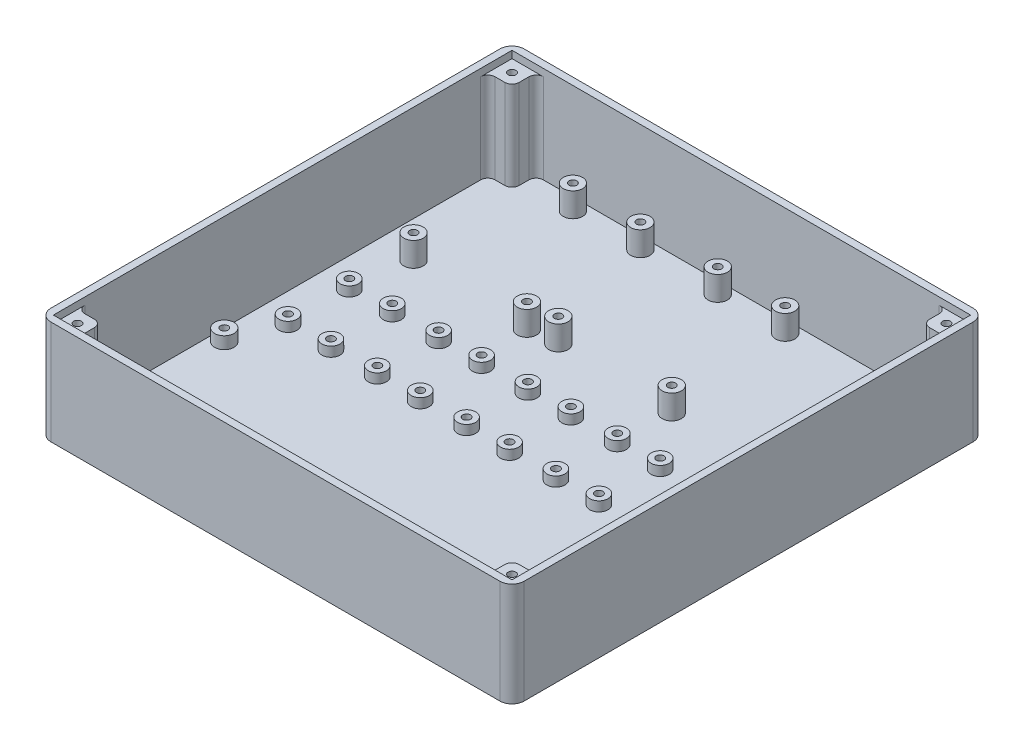
from build123d import *

# Parameters (mm, degrees)
SKETCH1_W               = 190
SKETCH1_H               = 190
BOSS_EXTRUDE1_DEPTH     = 40
SHELL1_T                = 3
FILLET1_R               = 5
SKETCH5_W               = 10
SKETCH5_H               = 10
SKETCH5_R               = 1.6
BOSS_EXTRUDE3_DEPTH     = 37
MIRROR2_COPY_1_SKETCH_W = 10
MIRROR2_COPY_1_SKETCH_H = 10
MIRROR2_COPY_1_SKETCH_R = 1.6
MIRROR2_COPY_1_DEPTH    = 37
FILLET3_R               = 3
SKETCH6_R               = 3.75
SKETCH6_R_2             = 1.6
BOSS_EXTRUDE4_DEPTH     = 7
LPATTERN1_COUNT         = 5
LPATTERN1_PITCH         = 37
SKETCH7_R               = 4
SKETCH7_R_2             = 1.6
BOSS_EXTRUDE5_DEPTH     = 5
SKETCH8_R               = 4
SKETCH8_R_2             = 1.6
BOSS_EXTRUDE6_DEPTH     = 10
LPATTERN2_COUNT         = 2
LPATTERN2_PITCH         = 60


with BuildPart() as part:
    # Sketch1 → Boss-Extrude1 (new body)
    with BuildSketch(Plane(origin=(0, 0, 0), x_dir=(1, 0, 0), z_dir=(0, 1, 0))):
        Rectangle(SKETCH1_W, SKETCH1_H)
    extrude(amount=BOSS_EXTRUDE1_DEPTH)

    # Shell1
    shell1_openings = [part.faces().sort_by_distance(p)[0] for p in [
        (0, 40, 0),
    ]]
    offset(amount=SHELL1_T, openings=shell1_openings, kind=Kind.INTERSECTION)

    # Fillet1
    # the kernel refuses this fillet: 5 mm, written as the material it takes off along each edge
    with BuildSketch(Plane(origin=(-98, 52.5, 98), x_dir=(1, 0, 0), z_dir=(0, -1, 0)), Plane(origin=(98, -15.5, 98), x_dir=(-1, 0, 0), z_dir=(0, 1, 0)), Plane(origin=(98, -15.5, -98), x_dir=(0, 0, 1), z_dir=(0, 1, 0)), Plane(origin=(-98, -15.5, -98), x_dir=(1, 0, 0), z_dir=(0, 1, 0))) as fillet1_piece_1:
        with BuildLine():
            CenterArc((FILLET1_R, -FILLET1_R), FILLET1_R, 90, 90)
            Line((0, -FILLET1_R), (0, 0))
            Line((0, 0), (FILLET1_R, 0))
        make_face()
    extrude(amount=68, mode=Mode.SUBTRACT)

    # Sketch5 → Boss-Extrude3 (add)
    with BuildSketch(Plane(origin=(0, 0, 0), x_dir=(1, 0, 0), z_dir=(0, 1, 0))):
        with Locations((-90, 90)):
            Rectangle(SKETCH5_W, SKETCH5_H)
        with Locations(Location((-90, 90, 0), (0, 0, 270))):
            Circle(SKETCH5_R, mode=Mode.SUBTRACT)
    boss_extrude3 = extrude(amount=BOSS_EXTRUDE3_DEPTH)

    # Mirror1: Boss-Extrude3 across plane
    add(boss_extrude3.mirror(Plane(origin=(0, 0, 0), x_dir=(0, 0, 1), z_dir=(1, 0, 0))))

    # Mirror2: Boss-Extrude3 across plane
    add(boss_extrude3.mirror(Plane.XY))

    # Mirror2 copy 1 sketch → Mirror2 copy 1 (add)
    with BuildSketch(Plane(origin=(0, 0, 0), x_dir=(-1, 0, 0), z_dir=(0, 1, 0))):
        with Locations((-90, 90)):
            Rectangle(MIRROR2_COPY_1_SKETCH_W, MIRROR2_COPY_1_SKETCH_H)
        with Locations(Location((-90, 90, 0), (0, 0, 270))):
            Circle(MIRROR2_COPY_1_SKETCH_R, mode=Mode.SUBTRACT)
    extrude(amount=MIRROR2_COPY_1_DEPTH)

    # Fillet3
    fillet3_edges = [part.edges().sort_by_distance(p)[0] for p in [
        (-95, 18.5, 85),
        (-85, 18.5, 95),
        (-85, 18.5, 85),
        (-95, 18.5, -85),
        (-85, 18.5, -85),
        (-85, 18.5, -95),
        (95, 18.5, -85),
        (85, 18.5, -95),
        (85, 18.5, -85),
        (95, 18.5, 85),
        (85, 18.5, 85),
        (85, 18.5, 95),
    ]]
    fillet(fillet3_edges, radius=FILLET3_R)

    # Sketch6 → Boss-Extrude4 (add)
    # profile 1 of 4: a face of its own
    with BuildSketch(Plane(origin=(0, -3, 0), x_dir=(1, 0, 0), z_dir=(0, 1, 0))):
        with Locations(Location((-65, 15.4, 0), (0, 0, 90))):
            Circle(SKETCH6_R)
        with Locations(Location((-65, 15.4, 0), (0, 0, 90))):
            Circle(SKETCH6_R_2, mode=Mode.SUBTRACT)
    # profile 2 of 4: a face of its own
    with BuildSketch(Plane(origin=(0, -3, 0), x_dir=(1, 0, 0), z_dir=(0, 1, 0))):
        with Locations(Location((-65, -10, 0), (0, 0, 90))):
            Circle(SKETCH6_R)
        with Locations(Location((-65, -10, 0), (0, 0, 90))):
            Circle(SKETCH6_R_2, mode=Mode.SUBTRACT)
    # profile 3 of 4: a face of its own
    with BuildSketch(Plane(origin=(0, -3, 0), x_dir=(1, 0, 0), z_dir=(0, 1, 0))):
        with Locations(Location((-82.8, 15.4, 0), (0, 0, 90))):
            Circle(SKETCH6_R)
        with Locations(Location((-82.8, 15.4, 0), (0, 0, 90))):
            Circle(SKETCH6_R_2, mode=Mode.SUBTRACT)
    # profile 4 of 4: a face of its own
    with BuildSketch(Plane(origin=(0, -3, 0), x_dir=(1, 0, 0), z_dir=(0, 1, 0))):
        with Locations(Location((-82.8, -10, 0), (0, 0, 90))):
            Circle(SKETCH6_R)
        with Locations(Location((-82.8, -10, 0), (0, 0, 90))):
            Circle(SKETCH6_R_2, mode=Mode.SUBTRACT)
    boss_extrude4 = extrude(amount=BOSS_EXTRUDE4_DEPTH)

    # LPattern1: Boss-Extrude4 ×5
    with Locations(*[(i * LPATTERN1_PITCH, 0, 0) for i in range(1, LPATTERN1_COUNT)]):
        add(boss_extrude4)

    # Sketch7 → Boss-Extrude5 (add)
    # profile 1 of 4: a face of its own
    with BuildSketch(Plane(origin=(0, 0, 0), x_dir=(1, 0, 0), z_dir=(0, 1, 0))):
        with Locations(Location((-90, -29.2, 0), (0, 0, 90))):
            Circle(SKETCH7_R)
        with Locations(Location((-90, -29.2, 0), (0, 0, 270))):
            Circle(SKETCH7_R_2, mode=Mode.SUBTRACT)
    # profile 2 of 4: a face of its own
    with BuildSketch(Plane(origin=(0, 0, 0), x_dir=(1, 0, 0), z_dir=(0, 1, 0))):
        with Locations(Location((-90, -80, 0), (0, 0, 90))):
            Circle(SKETCH7_R)
        with Locations(Location((-90, -80, 0), (0, 0, 270))):
            Circle(SKETCH7_R_2, mode=Mode.SUBTRACT)
    # profile 3 of 4: a face of its own
    with BuildSketch(Plane(origin=(0, 0, 0), x_dir=(1, 0, 0), z_dir=(0, 1, 0))):
        with Locations(Location((70, -80, 0), (0, 0, 90))):
            Circle(SKETCH7_R)
        with Locations(Location((70, -80, 0), (0, 0, 270))):
            Circle(SKETCH7_R_2, mode=Mode.SUBTRACT)
    # profile 4 of 4: a face of its own
    with BuildSketch(Plane(origin=(0, 0, 0), x_dir=(1, 0, 0), z_dir=(0, 1, 0))):
        with Locations(Location((70, -29.2, 0), (0, 0, 90))):
            Circle(SKETCH7_R)
        with Locations(Location((70, -29.2, 0), (0, 0, 270))):
            Circle(SKETCH7_R_2, mode=Mode.SUBTRACT)
    extrude(amount=BOSS_EXTRUDE5_DEPTH)

    # Sketch8 → Boss-Extrude6 (add)
    # profile 1 of 4: a face of its own
    with BuildSketch(Plane(origin=(0, 0, 0), x_dir=(1, 0, 0), z_dir=(0, 1, 0))):
        with Locations(Location((-31.74, 37.93, 0), (0, 0, 90))):
            Circle(SKETCH8_R)
        with Locations(Location((-31.74, 37.93, 0), (0, 0, 270))):
            Circle(SKETCH8_R_2, mode=Mode.SUBTRACT)
    # profile 2 of 4: a face of its own
    with BuildSketch(Plane(origin=(0, 0, 0), x_dir=(1, 0, 0), z_dir=(0, 1, 0))):
        with Locations(Location((-36.82, 90, 0), (0, 0, 90))):
            Circle(SKETCH8_R)
        with Locations(Location((-36.82, 90, 0), (0, 0, 270))):
            Circle(SKETCH8_R_2, mode=Mode.SUBTRACT)
    # profile 3 of 4: a face of its own
    with BuildSketch(Plane(origin=(0, 0, 0), x_dir=(1, 0, 0), z_dir=(0, 1, 0))):
        with Locations(Location((-80, 39.2, 0), (0, 0, 90))):
            Circle(SKETCH8_R)
        with Locations(Location((-80, 39.2, 0), (0, 0, 270))):
            Circle(SKETCH8_R_2, mode=Mode.SUBTRACT)
    # profile 4 of 4: a face of its own
    with BuildSketch(Plane(origin=(0, 0, 0), x_dir=(1, 0, 0), z_dir=(0, 1, 0))):
        with Locations(Location((-64.76, 90, 0), (0, 0, 90))):
            Circle(SKETCH8_R)
        with Locations(Location((-64.76, 90, 0), (0, 0, 270))):
            Circle(SKETCH8_R_2, mode=Mode.SUBTRACT)
    boss_extrude6 = extrude(amount=BOSS_EXTRUDE6_DEPTH)

    # LPattern2: Boss-Extrude6 ×2
    with Locations(*[(i * LPATTERN2_PITCH, 0, 0) for i in range(1, LPATTERN2_COUNT)]):
        add(boss_extrude6)


solid = part.part
